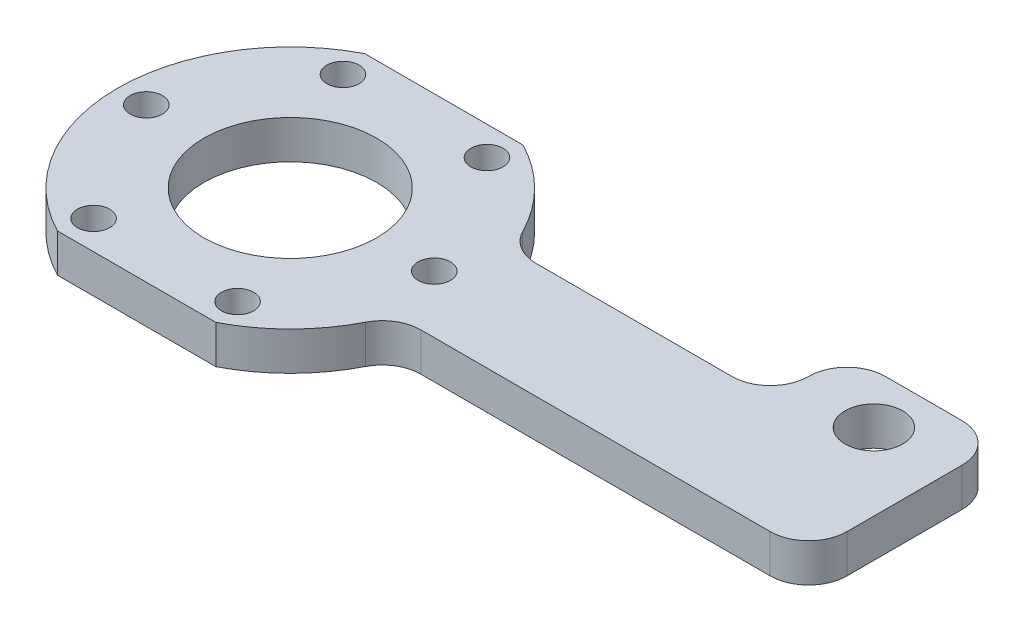
from build123d import *

# Parameters (mm, degrees)
SKETCH1_R           = 28.575
SKETCH1_R_2         = 14.2875
SKETCH1_R_3         = 2.667
BOSS_EXTRUDE1_DEPTH = 6.35
BOSS_EXTRUDE2_DEPTH = 6.35
SKETCH3_W           = 25.4
SKETCH3_H           = 12.7
BOSS_EXTRUDE3_DEPTH = 6.35
CUT_EXTRUDE4_REACH  = 101.646
SKETCH4_R           = 4.7625
FILLET1_R           = 6.35
SKETCH5_W           = 86.18949407
SKETCH5_H           = 10.684979127
CUT_EXTRUDE5_DEPTH  = 100.646453148


with BuildPart() as part:
    # Sketch1 → Boss-Extrude1 (new body)
    with BuildSketch(Plane(origin=(0, 0, 0), x_dir=(1, 0, 0), z_dir=(0, 1, 0))):
        with Locations(Location((0, 0, 0), (0, 0, 270))):
            Circle(SKETCH1_R)
        with Locations(Location((0, 0, 0), (0, 0, 270))):
            Circle(SKETCH1_R_2, mode=Mode.SUBTRACT)
        with Locations(Location((11.90625, 20.622229928, 0), (0, 0, 270))):
            Circle(SKETCH1_R_3, mode=Mode.SUBTRACT)
        with Locations(Location((23.8125, 0, 0), (0, 0, 270))):
            Circle(SKETCH1_R_3, mode=Mode.SUBTRACT)
        with Locations(Location((11.90625, -20.622229928, 0), (0, 0, 270))):
            Circle(SKETCH1_R_3, mode=Mode.SUBTRACT)
        with Locations(Location((-11.90625, -20.622229928, 0), (0, 0, 270))):
            Circle(SKETCH1_R_3, mode=Mode.SUBTRACT)
        with Locations(Location((-23.8125, 0, 0), (0, 0, 270))):
            Circle(SKETCH1_R_3, mode=Mode.SUBTRACT)
        with Locations(Location((-11.90625, 20.622229928, 0), (0, 0, 270))):
            Circle(SKETCH1_R_3, mode=Mode.SUBTRACT)
    extrude(amount=BOSS_EXTRUDE1_DEPTH)

    # Sketch2 → Boss-Extrude2 (add)
    with BuildSketch(Plane(origin=(0, 0, 0), x_dir=(1, 0, 0), z_dir=(0, 1, 0))):
        with BuildLine():
            Line((26.940768363, -9.525), (95.25, -9.525))
            Line((95.25, -9.525), (95.25, 9.525))
            Line((95.25, 9.525), (26.940768363, 9.525))
            ThreePointArc((26.940768363, 9.525), (28.575, 0), (26.940768363, -9.525))
        make_face()
    extrude(amount=BOSS_EXTRUDE2_DEPTH)

    # Sketch3 → Boss-Extrude3 (add)
    with BuildSketch(Plane(origin=(0, 6.35, 0), x_dir=(1, 0, 0), z_dir=(0, 1, 0))):
        with Locations((82.55, 15.875)):
            Rectangle(SKETCH3_W, SKETCH3_H)
    extrude(amount=-BOSS_EXTRUDE3_DEPTH)

    # Sketch4 → Cut-Extrude4 (cut, up to next)
    with BuildSketch(Plane(origin=(0, 0, 0), x_dir=(1, 0, 0), z_dir=(0, 1, 0)), mode=Mode.PRIVATE) as cut_extrude4_sk1:
        with Locations(Location((82.55, 13.97, 0), (0, 0, 270))):
            Circle(SKETCH4_R)
    cut_extrude4_tool1 = extrude(cut_extrude4_sk1.sketch, amount=CUT_EXTRUDE4_REACH, mode=Mode.PRIVATE) & part.part
    add(cut_extrude4_tool1.solids().sort_by_distance((82.55, 0, -13.97))[0], mode=Mode.SUBTRACT)

    # Fillet1
    fillet1_edges = [part.edges().sort_by_distance(p)[0] for p in [
        (69.85, 3.175, -9.525),
        (95.25, 3.175, 9.525),
        (69.85, 3.175, -22.225),
        (95.25, 3.175, -22.225),
        (26.940768363, 3.175, 9.525),
        (26.940768363, 3.175, -9.525),
    ]]
    fillet(fillet1_edges, radius=FILLET1_R - 0.0001)  # a hair under: the kernel refuses the full size

    # Sketch5 → Cut-Extrude5 (cut, through all)
    with BuildSketch(Plane(origin=(0, 6.35, 0), x_dir=(1, 0, 0), z_dir=(0, 1, 0))):
        with Locations((4.822558491, 30.742489564)):
            Rectangle(SKETCH5_W, SKETCH5_H)
        with Locations((4.822558491, -30.742489564)):
            Rectangle(SKETCH5_W, SKETCH5_H)
    extrude(amount=-CUT_EXTRUDE5_DEPTH, mode=Mode.SUBTRACT)


solid = part.part
